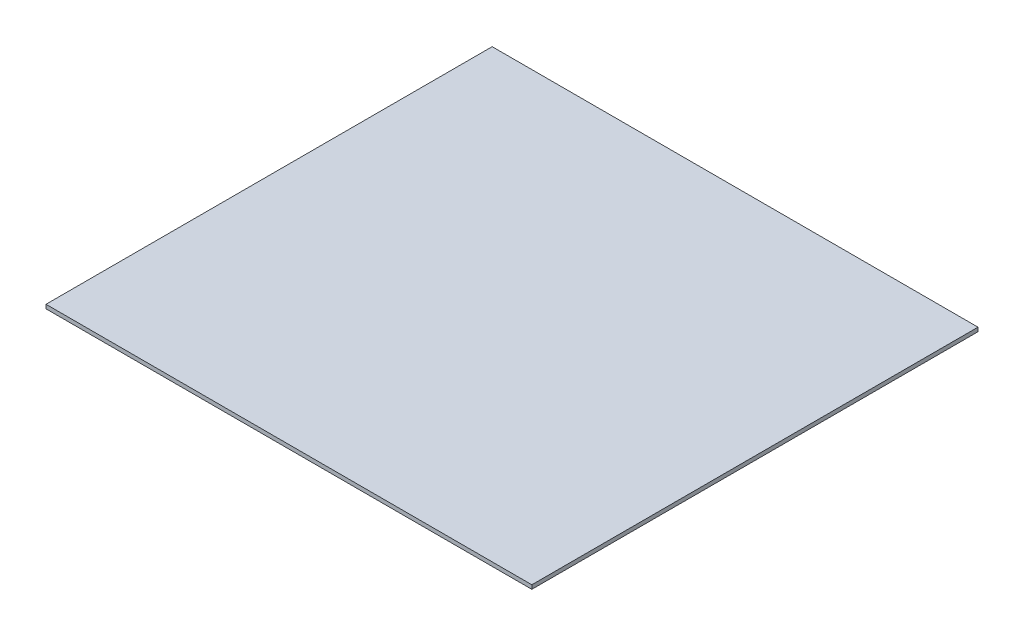
from build123d import *

# Parameters (mm, degrees)
SZKIC1_W               = 490
SZKIC1_H               = 450
ODGI_CIE_BAZOWE1_DEPTH = 4


# Sheet-metal steps are written as plain solids
with BuildPart() as part:
    # Szkic1 → Odgięcie bazowe1 (new body)
    with BuildSketch(Plane(origin=(0, 0, 0), x_dir=(1, 0, 0), z_dir=(0, 1, 0))):
        Rectangle(SZKIC1_W, SZKIC1_H)
    extrude(amount=-ODGI_CIE_BAZOWE1_DEPTH)


solid = part.part
